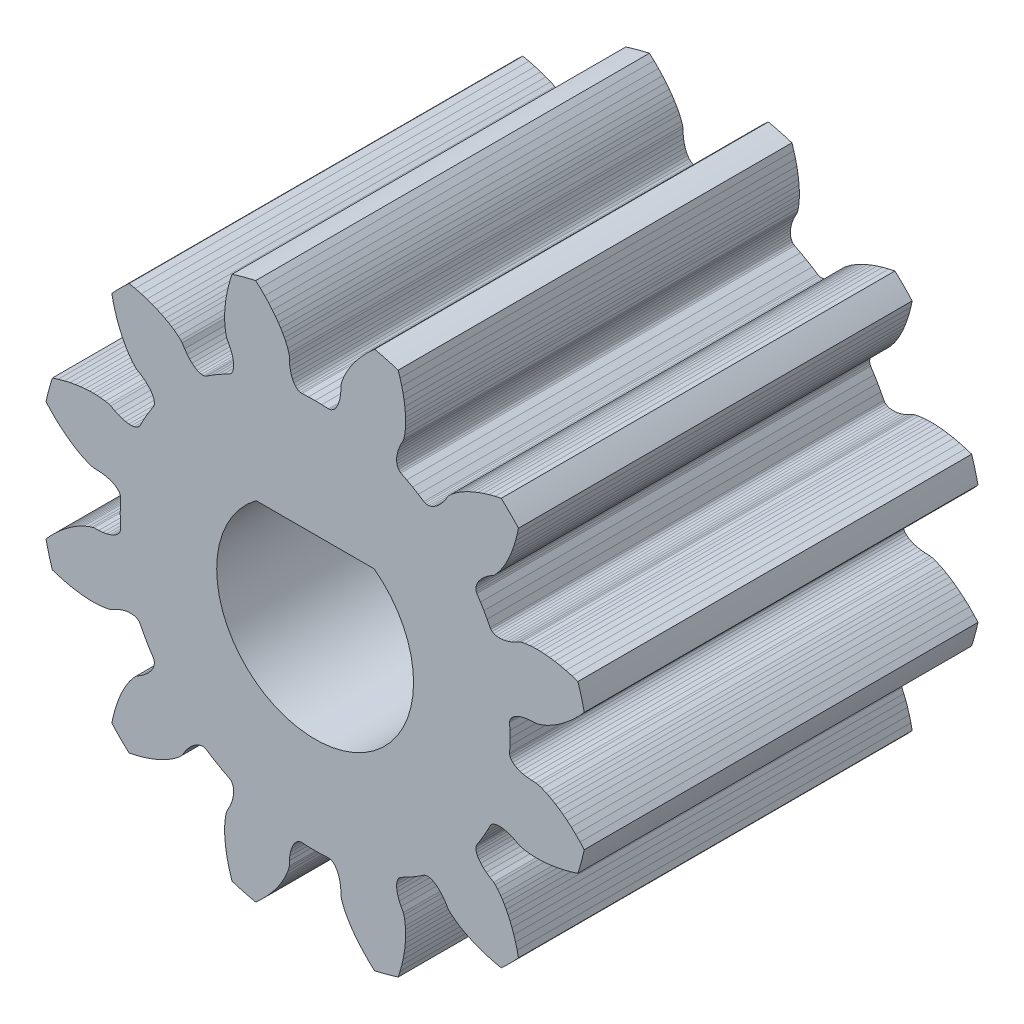
from build123d import *

# Parameters (mm, degrees)
MODEL_R             = 2.5
BOSS_EXTRUDE1_DEPTH = 10
SKETCH2_W           = 5.654663585
SKETCH2_H           = 1.514293935
BOSS_EXTRUDE2_DEPTH = 10


with BuildPart() as part:
    # Model → Boss-Extrude1 (new body)
    with BuildSketch(Plane.XY):
        with BuildLine():
            Line((30.8693845, -4.5708333), (30.9097848, -4.4160686))
            Line((30.9097848, -4.4160686), (30.953786, -4.2724809))
            Line((30.953786, -4.2724809), (31.0002786, -4.1407685))
            Line((31.0002786, -4.1407685), (31.0487652, -4.0198098))
            Line((31.0487652, -4.0198098), (31.0976506, -3.9112417))
            Line((31.0976506, -3.9112417), (31.1474591, -3.8119326))
            Line((31.1474591, -3.8119326), (31.1956452, -3.7251533))
            Line((31.1956452, -3.7251533), (31.2429181, -3.6477925))
            Line((31.2429181, -3.6477925), (31.2874834, -3.5813018))
            Line((31.2874834, -3.5813018), (31.3670654, -3.4769619))
            Line((31.3670654, -3.4769619), (31.4284965, -3.4089436))
            Line((31.4284965, -3.4089436), (31.4660329, -3.3745587))
            Line((31.4660329, -3.3745587), (31.5668109, -3.3141113))
            Line((31.5668109, -3.3141113), (31.6546587, -3.2515682))
            Line((31.6546587, -3.2515682), (31.7295821, -3.1879192))
            Line((31.7295821, -3.1879192), (31.7916695, -3.1241177))
            Line((31.7916695, -3.1241177), (31.8410468, -3.0611418))
            Line((31.8410468, -3.0611418), (31.8779217, -2.999911))
            Line((31.8779217, -2.999911), (31.9025353, -2.9413829))
            Line((31.9025353, -2.9413829), (31.9152053, -2.8864481))
            Line((31.9152053, -2.8864481), (31.9162819, -2.8360127))
            Line((31.9162819, -2.8360127), (31.906188, -2.7909297))
            Line((31.906188, -2.7909297), (31.8915643, -2.7611406))
            Line((31.8915643, -2.7611406), (31.8003034, -2.6201521))
            Line((31.8003034, -2.6201521), (31.7131743, -2.475))
            Line((31.7131743, -2.475), (31.6310334, -2.3269679))
            Line((31.6310334, -2.3269679), (31.5545643, -2.1774394))
            Line((31.5545643, -2.1774394), (31.536078, -2.1498803))
            Line((31.536078, -2.1498803), (31.5020819, -2.1185973))
            Line((31.5020819, -2.1185973), (31.4578653, -2.0943119))
            Line((31.4578653, -2.0943119), (31.4039553, -2.0778171))
            Line((31.4039553, -2.0778171), (31.3409617, -2.069869))
            Line((31.3409617, -2.069869), (31.2694968, -2.0711882))
            Line((31.2694968, -2.0711882), (31.1902695, -2.0824623))
            Line((31.1902695, -2.0824623), (31.1039721, -2.1043308))
            Line((31.1039721, -2.1043308), (31.0113887, -2.1373918))
            Line((31.0113887, -2.1373918), (30.9133009, -2.1821987))
            Line((30.9133009, -2.1821987), (30.8105629, -2.2392513))
            Line((30.8105629, -2.2392513), (30.7620165, -2.2545664))
            Line((30.7620165, -2.2545664), (30.6723954, -2.2737581))
            Line((30.6723954, -2.2737581), (30.5422434, -2.2905082))
            Line((30.5422434, -2.2905082), (30.4623781, -2.2958575))
            Line((30.4623781, -2.2958575), (30.3717452, -2.2981167))
            Line((30.3717452, -2.2981167), (30.2724991, -2.2964574))
            Line((30.2724991, -2.2964574), (30.1615906, -2.2899383))
            Line((30.1615906, -2.2899383), (30.0431252, -2.2779902))
            Line((30.0431252, -2.2779902), (29.9141286, -2.2595015))
            Line((29.9141286, -2.2595015), (29.776816, -2.2339091))
            Line((29.776816, -2.2339091), (29.6304648, -2.2002214))
            Line((29.6304648, -2.2002214), (29.4762345, -2.1578267))
            Line((29.4762345, -2.1578267), (29.325472271, -2.109558904))
            ThreePointArc((29.325472271, -2.109558904), (29.23854966, -1.811725181), (29.164909974, -1.510332309))
            Line((29.164909974, -1.510332309), (29.27134, -1.39315))
            Line((29.27134, -1.39315), (29.38371, -1.27932))
            Line((29.38371, -1.27932), (29.49361, -1.17697))
            Line((29.49361, -1.17697), (29.59973, -1.08615))
            Line((29.59973, -1.08615), (29.7022, -1.00564))
            Line((29.7022, -1.00564), (29.79882, -0.93606))
            Line((29.79882, -0.93606), (29.89161, -0.87496))
            Line((29.89161, -0.87496), (29.97673, -0.8239))
            Line((29.97673, -0.8239), (30.05635, -0.78054))
            Line((30.05635, -0.78054), (30.12819, -0.74524))
            Line((30.12819, -0.74524), (30.24928, -0.69467))
            Line((30.24928, -0.69467), (30.33649, -0.66648))
            Line((30.33649, -0.66648), (30.38619, -0.65547))
            Line((30.38619, -0.65547), (30.50369, -0.65351))
            Line((30.50369, -0.65351), (30.61104, -0.64327))
            Line((30.61104, -0.64327), (30.70775, -0.62561))
            Line((30.70775, -0.62561), (30.79342, -0.6014))
            Line((30.79342, -0.6014), (30.86767, -0.57155))
            Line((30.86767, -0.57155), (30.93022, -0.53696))
            Line((30.93022, -0.53696), (30.9808, -0.49858))
            Line((30.9808, -0.49858), (31.01924, -0.45734))
            Line((31.01924, -0.45734), (31.04539, -0.4142))
            Line((31.04539, -0.4142), (31.05919, -0.37011))
            Line((31.05919, -0.37011), (31.06142, -0.337))
            Line((31.06142, -0.337), (31.05288, -0.16927))
            Line((31.05288, -0.16927), (31.05, 0))
            Line((31.05, 0), (31.05288, 0.16927))
            Line((31.05288, 0.16927), (31.06142, 0.337))
            Line((31.06142, 0.337), (31.05919, 0.37011))
            Line((31.05919, 0.37011), (31.04539, 0.4142))
            Line((31.04539, 0.4142), (31.01924, 0.45734))
            Line((31.01924, 0.45734), (30.9808, 0.49858))
            Line((30.9808, 0.49858), (30.93022, 0.53696))
            Line((30.93022, 0.53696), (30.86767, 0.57155))
            Line((30.86767, 0.57155), (30.79342, 0.6014))
            Line((30.79342, 0.6014), (30.70775, 0.62561))
            Line((30.70775, 0.62561), (30.61104, 0.64327))
            Line((30.61104, 0.64327), (30.50369, 0.65351))
            Line((30.50369, 0.65351), (30.38619, 0.65547))
            Line((30.38619, 0.65547), (30.33649, 0.66648))
            Line((30.33649, 0.66648), (30.24928, 0.69467))
            Line((30.24928, 0.69467), (30.12819, 0.74524))
            Line((30.12819, 0.74524), (30.05635, 0.78054))
            Line((30.05635, 0.78054), (29.97673, 0.8239))
            Line((29.97673, 0.8239), (29.89161, 0.87496))
            Line((29.89161, 0.87496), (29.79882, 0.93606))
            Line((29.79882, 0.93606), (29.7022, 1.00564))
            Line((29.7022, 1.00564), (29.59973, 1.08615))
            Line((29.59973, 1.08615), (29.49361, 1.17697))
            Line((29.49361, 1.17697), (29.38371, 1.27932))
            Line((29.38371, 1.27932), (29.27134, 1.39315))
            Line((29.27134, 1.39315), (29.164909974, 1.510332309))
            ThreePointArc((29.164909974, 1.510332309), (29.23854966, 1.811725181), (29.325472271, 2.109558904))
            Line((29.325472271, 2.109558904), (29.4762345, 2.1578267))
            Line((29.4762345, 2.1578267), (29.6304648, 2.2002214))
            Line((29.6304648, 2.2002214), (29.776816, 2.2339091))
            Line((29.776816, 2.2339091), (29.9141286, 2.2595015))
            Line((29.9141286, 2.2595015), (30.0431252, 2.2779902))
            Line((30.0431252, 2.2779902), (30.1615906, 2.2899383))
            Line((30.1615906, 2.2899383), (30.2724991, 2.2964574))
            Line((30.2724991, 2.2964574), (30.3717452, 2.2981167))
            Line((30.3717452, 2.2981167), (30.4623781, 2.2958575))
            Line((30.4623781, 2.2958575), (30.5422434, 2.2905082))
            Line((30.5422434, 2.2905082), (30.6723954, 2.2737581))
            Line((30.6723954, 2.2737581), (30.7620165, 2.2545664))
            Line((30.7620165, 2.2545664), (30.8105629, 2.2392513))
            Line((30.8105629, 2.2392513), (30.9133009, 2.1821987))
            Line((30.9133009, 2.1821987), (31.0113887, 2.1373918))
            Line((31.0113887, 2.1373918), (31.1039721, 2.1043308))
            Line((31.1039721, 2.1043308), (31.1902695, 2.0824623))
            Line((31.1902695, 2.0824623), (31.2694968, 2.0711882))
            Line((31.2694968, 2.0711882), (31.3409617, 2.069869))
            Line((31.3409617, 2.069869), (31.4039553, 2.0778171))
            Line((31.4039553, 2.0778171), (31.4578653, 2.0943119))
            Line((31.4578653, 2.0943119), (31.5020819, 2.1185973))
            Line((31.5020819, 2.1185973), (31.536078, 2.1498803))
            Line((31.536078, 2.1498803), (31.5545643, 2.1774394))
            Line((31.5545643, 2.1774394), (31.6310334, 2.3269679))
            Line((31.6310334, 2.3269679), (31.7131743, 2.475))
            Line((31.7131743, 2.475), (31.8003034, 2.6201521))
            Line((31.8003034, 2.6201521), (31.8915643, 2.7611406))
            Line((31.8915643, 2.7611406), (31.906188, 2.7909297))
            Line((31.906188, 2.7909297), (31.9162819, 2.8360127))
            Line((31.9162819, 2.8360127), (31.9152053, 2.8864481))
            Line((31.9152053, 2.8864481), (31.9025353, 2.9413829))
            Line((31.9025353, 2.9413829), (31.8779217, 2.999911))
            Line((31.8779217, 2.999911), (31.8410468, 3.0611418))
            Line((31.8410468, 3.0611418), (31.7916695, 3.1241177))
            Line((31.7916695, 3.1241177), (31.7295821, 3.1879192))
            Line((31.7295821, 3.1879192), (31.6546587, 3.2515682))
            Line((31.6546587, 3.2515682), (31.5668109, 3.3141113))
            Line((31.5668109, 3.3141113), (31.4660329, 3.3745587))
            Line((31.4660329, 3.3745587), (31.4284965, 3.4089436))
            Line((31.4284965, 3.4089436), (31.3670654, 3.4769619))
            Line((31.3670654, 3.4769619), (31.2874834, 3.5813018))
            Line((31.2874834, 3.5813018), (31.2429181, 3.6477925))
            Line((31.2429181, 3.6477925), (31.1956452, 3.7251533))
            Line((31.1956452, 3.7251533), (31.1474591, 3.8119326))
            Line((31.1474591, 3.8119326), (31.0976506, 3.9112417))
            Line((31.0976506, 3.9112417), (31.0487652, 4.0198098))
            Line((31.0487652, 4.0198098), (31.0002786, 4.1407685))
            Line((31.0002786, 4.1407685), (30.953786, 4.2724809))
            Line((30.953786, 4.2724809), (30.9097848, 4.4160686))
            Line((30.9097848, 4.4160686), (30.8693845, 4.5708333))
            Line((30.8693845, 4.5708333), (30.83580457, 4.725531132))
            ThreePointArc((30.83580457, 4.725531132), (31.050274832, 4.949725168), (31.274468868, 5.16419543))
            Line((31.274468868, 5.16419543), (31.4291667, 5.1306155))
            Line((31.4291667, 5.1306155), (31.5839314, 5.0902152))
            Line((31.5839314, 5.0902152), (31.7275191, 5.046214))
            Line((31.7275191, 5.046214), (31.8592315, 4.9997214))
            Line((31.8592315, 4.9997214), (31.9801902, 4.9512348))
            Line((31.9801902, 4.9512348), (32.0887583, 4.9023494))
            Line((32.0887583, 4.9023494), (32.1880674, 4.8525409))
            Line((32.1880674, 4.8525409), (32.2748467, 4.8043548))
            Line((32.2748467, 4.8043548), (32.3522075, 4.7570819))
            Line((32.3522075, 4.7570819), (32.4186982, 4.7125166))
            Line((32.4186982, 4.7125166), (32.5230381, 4.6329346))
            Line((32.5230381, 4.6329346), (32.5910564, 4.5715035))
            Line((32.5910564, 4.5715035), (32.6254413, 4.5339671))
            Line((32.6254413, 4.5339671), (32.6858887, 4.4331891))
            Line((32.6858887, 4.4331891), (32.7484318, 4.3453413))
            Line((32.7484318, 4.3453413), (32.8120808, 4.2704179))
            Line((32.8120808, 4.2704179), (32.8758823, 4.2083305))
            Line((32.8758823, 4.2083305), (32.9388582, 4.1589532))
            Line((32.9388582, 4.1589532), (33.000089, 4.1220783))
            Line((33.000089, 4.1220783), (33.0586171, 4.0974647))
            Line((33.0586171, 4.0974647), (33.1135519, 4.0847947))
            Line((33.1135519, 4.0847947), (33.1639873, 4.0837181))
            Line((33.1639873, 4.0837181), (33.2090703, 4.093812))
            Line((33.2090703, 4.093812), (33.2388594, 4.1084357))
            Line((33.2388594, 4.1084357), (33.3798479, 4.1996966))
            Line((33.3798479, 4.1996966), (33.525, 4.2868257))
            Line((33.525, 4.2868257), (33.6730321, 4.3689666))
            Line((33.6730321, 4.3689666), (33.8225606, 4.4454357))
            Line((33.8225606, 4.4454357), (33.8501197, 4.463922))
            Line((33.8501197, 4.463922), (33.8814027, 4.4979181))
            Line((33.8814027, 4.4979181), (33.9056881, 4.5421347))
            Line((33.9056881, 4.5421347), (33.9221829, 4.5960447))
            Line((33.9221829, 4.5960447), (33.930131, 4.6590383))
            Line((33.930131, 4.6590383), (33.9288118, 4.7305032))
            Line((33.9288118, 4.7305032), (33.9175377, 4.8097305))
            Line((33.9175377, 4.8097305), (33.8956692, 4.8960279))
            Line((33.8956692, 4.8960279), (33.8626082, 4.9886113))
            Line((33.8626082, 4.9886113), (33.8178013, 5.0866991))
            Line((33.8178013, 5.0866991), (33.7607487, 5.1894371))
            Line((33.7607487, 5.1894371), (33.7454336, 5.2379835))
            Line((33.7454336, 5.2379835), (33.7262419, 5.3276046))
            Line((33.7262419, 5.3276046), (33.7094918, 5.4577566))
            Line((33.7094918, 5.4577566), (33.7041425, 5.5376219))
            Line((33.7041425, 5.5376219), (33.7018833, 5.6282548))
            Line((33.7018833, 5.6282548), (33.7035426, 5.7275009))
            Line((33.7035426, 5.7275009), (33.7100617, 5.8384094))
            Line((33.7100617, 5.8384094), (33.7220098, 5.9568748))
            Line((33.7220098, 5.9568748), (33.7404985, 6.0858714))
            Line((33.7404985, 6.0858714), (33.7660909, 6.223184))
            Line((33.7660909, 6.223184), (33.7997786, 6.3695352))
            Line((33.7997786, 6.3695352), (33.8421733, 6.5237655))
            Line((33.8421733, 6.5237655), (33.890441096, 6.674527729))
            ThreePointArc((33.890441096, 6.674527729), (34.188274819, 6.76145034), (34.489667691, 6.835090026))
            Line((34.489667691, 6.835090026), (34.60685, 6.72866))
            Line((34.60685, 6.72866), (34.72068, 6.61629))
            Line((34.72068, 6.61629), (34.82303, 6.50639))
            Line((34.82303, 6.50639), (34.91385, 6.40027))
            Line((34.91385, 6.40027), (34.99436, 6.2978))
            Line((34.99436, 6.2978), (35.06394, 6.20118))
            Line((35.06394, 6.20118), (35.12504, 6.10839))
            Line((35.12504, 6.10839), (35.1761, 6.02327))
            Line((35.1761, 6.02327), (35.21946, 5.94365))
            Line((35.21946, 5.94365), (35.25476, 5.87181))
            Line((35.25476, 5.87181), (35.30533, 5.75072))
            Line((35.30533, 5.75072), (35.33352, 5.66351))
            Line((35.33352, 5.66351), (35.34453, 5.61381))
            Line((35.34453, 5.61381), (35.34649, 5.49631))
            Line((35.34649, 5.49631), (35.35673, 5.38896))
            Line((35.35673, 5.38896), (35.37439, 5.29225))
            Line((35.37439, 5.29225), (35.3986, 5.20658))
            Line((35.3986, 5.20658), (35.42845, 5.13233))
            Line((35.42845, 5.13233), (35.46304, 5.06978))
            Line((35.46304, 5.06978), (35.50142, 5.0192))
            Line((35.50142, 5.0192), (35.54266, 4.98076))
            Line((35.54266, 4.98076), (35.5858, 4.95461))
            Line((35.5858, 4.95461), (35.62989, 4.94081))
            Line((35.62989, 4.94081), (35.663, 4.93858))
            Line((35.663, 4.93858), (35.83073, 4.94712))
            Line((35.83073, 4.94712), (36, 4.95))
            Line((36, 4.95), (36.16927, 4.94712))
            Line((36.16927, 4.94712), (36.337, 4.93858))
            Line((36.337, 4.93858), (36.37011, 4.94081))
            Line((36.37011, 4.94081), (36.4142, 4.95461))
            Line((36.4142, 4.95461), (36.45734, 4.98076))
            Line((36.45734, 4.98076), (36.49858, 5.0192))
            Line((36.49858, 5.0192), (36.53696, 5.06978))
            Line((36.53696, 5.06978), (36.57155, 5.13233))
            Line((36.57155, 5.13233), (36.6014, 5.20658))
            Line((36.6014, 5.20658), (36.62561, 5.29225))
            Line((36.62561, 5.29225), (36.64327, 5.38896))
            Line((36.64327, 5.38896), (36.65351, 5.49631))
            Line((36.65351, 5.49631), (36.65547, 5.61381))
            Line((36.65547, 5.61381), (36.66648, 5.66351))
            Line((36.66648, 5.66351), (36.69467, 5.75072))
            Line((36.69467, 5.75072), (36.74524, 5.87181))
            Line((36.74524, 5.87181), (36.78054, 5.94365))
            Line((36.78054, 5.94365), (36.8239, 6.02327))
            Line((36.8239, 6.02327), (36.87496, 6.10839))
            Line((36.87496, 6.10839), (36.93606, 6.20118))
            Line((36.93606, 6.20118), (37.00564, 6.2978))
            Line((37.00564, 6.2978), (37.08615, 6.40027))
            Line((37.08615, 6.40027), (37.17697, 6.50639))
            Line((37.17697, 6.50639), (37.27932, 6.61629))
            Line((37.27932, 6.61629), (37.39315, 6.72866))
            Line((37.39315, 6.72866), (37.510332309, 6.835090026))
            ThreePointArc((37.510332309, 6.835090026), (37.811725181, 6.76145034), (38.109558904, 6.674527729))
            Line((38.109558904, 6.674527729), (38.1578267, 6.5237655))
            Line((38.1578267, 6.5237655), (38.2002214, 6.3695352))
            Line((38.2002214, 6.3695352), (38.2339091, 6.223184))
            Line((38.2339091, 6.223184), (38.2595015, 6.0858714))
            Line((38.2595015, 6.0858714), (38.2779902, 5.9568748))
            Line((38.2779902, 5.9568748), (38.2899383, 5.8384094))
            Line((38.2899383, 5.8384094), (38.2964574, 5.7275009))
            Line((38.2964574, 5.7275009), (38.2981167, 5.6282548))
            Line((38.2981167, 5.6282548), (38.2958575, 5.5376219))
            Line((38.2958575, 5.5376219), (38.2905082, 5.4577566))
            Line((38.2905082, 5.4577566), (38.2737581, 5.3276046))
            Line((38.2737581, 5.3276046), (38.2545664, 5.2379835))
            Line((38.2545664, 5.2379835), (38.2392513, 5.1894371))
            Line((38.2392513, 5.1894371), (38.1821987, 5.0866991))
            Line((38.1821987, 5.0866991), (38.1373918, 4.9886113))
            Line((38.1373918, 4.9886113), (38.1043308, 4.8960279))
            Line((38.1043308, 4.8960279), (38.0824623, 4.8097305))
            Line((38.0824623, 4.8097305), (38.0711882, 4.7305032))
            Line((38.0711882, 4.7305032), (38.069869, 4.6590383))
            Line((38.069869, 4.6590383), (38.0778171, 4.5960447))
            Line((38.0778171, 4.5960447), (38.0943119, 4.5421347))
            Line((38.0943119, 4.5421347), (38.1185973, 4.4979181))
            Line((38.1185973, 4.4979181), (38.1498803, 4.463922))
            Line((38.1498803, 4.463922), (38.1774394, 4.4454357))
            Line((38.1774394, 4.4454357), (38.3269679, 4.3689666))
            Line((38.3269679, 4.3689666), (38.475, 4.2868257))
            Line((38.475, 4.2868257), (38.6201521, 4.1996966))
            Line((38.6201521, 4.1996966), (38.7611406, 4.1084357))
            Line((38.7611406, 4.1084357), (38.7909297, 4.093812))
            Line((38.7909297, 4.093812), (38.8360127, 4.0837181))
            Line((38.8360127, 4.0837181), (38.8864481, 4.0847947))
            Line((38.8864481, 4.0847947), (38.9413829, 4.0974647))
            Line((38.9413829, 4.0974647), (38.999911, 4.1220783))
            Line((38.999911, 4.1220783), (39.0611418, 4.1589532))
            Line((39.0611418, 4.1589532), (39.1241177, 4.2083305))
            Line((39.1241177, 4.2083305), (39.1879192, 4.2704179))
            Line((39.1879192, 4.2704179), (39.2515682, 4.3453413))
            Line((39.2515682, 4.3453413), (39.3141113, 4.4331891))
            Line((39.3141113, 4.4331891), (39.3745587, 4.5339671))
            Line((39.3745587, 4.5339671), (39.4089436, 4.5715035))
            Line((39.4089436, 4.5715035), (39.4769619, 4.6329346))
            Line((39.4769619, 4.6329346), (39.5813018, 4.7125166))
            Line((39.5813018, 4.7125166), (39.6477925, 4.7570819))
            Line((39.6477925, 4.7570819), (39.7251533, 4.8043548))
            Line((39.7251533, 4.8043548), (39.8119326, 4.8525409))
            Line((39.8119326, 4.8525409), (39.9112417, 4.9023494))
            Line((39.9112417, 4.9023494), (40.0198098, 4.9512348))
            Line((40.0198098, 4.9512348), (40.1407685, 4.9997214))
            Line((40.1407685, 4.9997214), (40.2724809, 5.046214))
            Line((40.2724809, 5.046214), (40.4160686, 5.0902152))
            Line((40.4160686, 5.0902152), (40.5708333, 5.1306155))
            Line((40.5708333, 5.1306155), (40.725531132, 5.16419543))
            ThreePointArc((40.725531132, 5.16419543), (40.949725168, 4.949725168), (41.16419543, 4.725531132))
            Line((41.16419543, 4.725531132), (41.1306155, 4.5708333))
            Line((41.1306155, 4.5708333), (41.0902152, 4.4160686))
            Line((41.0902152, 4.4160686), (41.046214, 4.2724809))
            Line((41.046214, 4.2724809), (40.9997214, 4.1407685))
            Line((40.9997214, 4.1407685), (40.9512348, 4.0198098))
            Line((40.9512348, 4.0198098), (40.9023494, 3.9112417))
            Line((40.9023494, 3.9112417), (40.8525409, 3.8119326))
            Line((40.8525409, 3.8119326), (40.8043548, 3.7251533))
            Line((40.8043548, 3.7251533), (40.7570819, 3.6477925))
            Line((40.7570819, 3.6477925), (40.7125166, 3.5813018))
            Line((40.7125166, 3.5813018), (40.6329346, 3.4769619))
            Line((40.6329346, 3.4769619), (40.5715035, 3.4089436))
            Line((40.5715035, 3.4089436), (40.5339671, 3.3745587))
            Line((40.5339671, 3.3745587), (40.4331891, 3.3141113))
            Line((40.4331891, 3.3141113), (40.3453413, 3.2515682))
            Line((40.3453413, 3.2515682), (40.2704179, 3.1879192))
            Line((40.2704179, 3.1879192), (40.2083305, 3.1241177))
            Line((40.2083305, 3.1241177), (40.1589532, 3.0611418))
            Line((40.1589532, 3.0611418), (40.1220783, 2.999911))
            Line((40.1220783, 2.999911), (40.0974647, 2.9413829))
            Line((40.0974647, 2.9413829), (40.0847947, 2.8864481))
            Line((40.0847947, 2.8864481), (40.0837181, 2.8360127))
            Line((40.0837181, 2.8360127), (40.093812, 2.7909297))
            Line((40.093812, 2.7909297), (40.1084357, 2.7611406))
            Line((40.1084357, 2.7611406), (40.1996966, 2.6201521))
            Line((40.1996966, 2.6201521), (40.2868257, 2.475))
            Line((40.2868257, 2.475), (40.3689666, 2.3269679))
            Line((40.3689666, 2.3269679), (40.4454357, 2.1774394))
            Line((40.4454357, 2.1774394), (40.463922, 2.1498803))
            Line((40.463922, 2.1498803), (40.4979181, 2.1185973))
            Line((40.4979181, 2.1185973), (40.5421347, 2.0943119))
            Line((40.5421347, 2.0943119), (40.5960447, 2.0778171))
            Line((40.5960447, 2.0778171), (40.6590383, 2.069869))
            Line((40.6590383, 2.069869), (40.7305032, 2.0711882))
            Line((40.7305032, 2.0711882), (40.8097305, 2.0824623))
            Line((40.8097305, 2.0824623), (40.8960279, 2.1043308))
            Line((40.8960279, 2.1043308), (40.9886113, 2.1373918))
            Line((40.9886113, 2.1373918), (41.0866991, 2.1821987))
            Line((41.0866991, 2.1821987), (41.1894371, 2.2392513))
            Line((41.1894371, 2.2392513), (41.2379835, 2.2545664))
            Line((41.2379835, 2.2545664), (41.3276046, 2.2737581))
            Line((41.3276046, 2.2737581), (41.4577566, 2.2905082))
            Line((41.4577566, 2.2905082), (41.5376219, 2.2958575))
            Line((41.5376219, 2.2958575), (41.6282548, 2.2981167))
            Line((41.6282548, 2.2981167), (41.7275009, 2.2964574))
            Line((41.7275009, 2.2964574), (41.8384094, 2.2899383))
            Line((41.8384094, 2.2899383), (41.9568748, 2.2779902))
            Line((41.9568748, 2.2779902), (42.0858714, 2.2595015))
            Line((42.0858714, 2.2595015), (42.223184, 2.2339091))
            Line((42.223184, 2.2339091), (42.3695352, 2.2002214))
            Line((42.3695352, 2.2002214), (42.5237655, 2.1578267))
            Line((42.5237655, 2.1578267), (42.674527729, 2.109558904))
            ThreePointArc((42.674527729, 2.109558904), (42.76145034, 1.811725181), (42.835090026, 1.510332309))
            Line((42.835090026, 1.510332309), (42.72866, 1.39315))
            Line((42.72866, 1.39315), (42.61629, 1.27932))
            Line((42.61629, 1.27932), (42.50639, 1.17697))
            Line((42.50639, 1.17697), (42.40027, 1.08615))
            Line((42.40027, 1.08615), (42.2978, 1.00564))
            Line((42.2978, 1.00564), (42.20118, 0.93606))
            Line((42.20118, 0.93606), (42.10839, 0.87496))
            Line((42.10839, 0.87496), (42.02327, 0.8239))
            Line((42.02327, 0.8239), (41.94365, 0.78054))
            Line((41.94365, 0.78054), (41.87181, 0.74524))
            Line((41.87181, 0.74524), (41.75072, 0.69467))
            Line((41.75072, 0.69467), (41.66351, 0.66648))
            Line((41.66351, 0.66648), (41.61381, 0.65547))
            Line((41.61381, 0.65547), (41.49631, 0.65351))
            Line((41.49631, 0.65351), (41.38896, 0.64327))
            Line((41.38896, 0.64327), (41.29225, 0.62561))
            Line((41.29225, 0.62561), (41.20658, 0.6014))
            Line((41.20658, 0.6014), (41.13233, 0.57155))
            Line((41.13233, 0.57155), (41.06978, 0.53696))
            Line((41.06978, 0.53696), (41.0192, 0.49858))
            Line((41.0192, 0.49858), (40.98076, 0.45734))
            Line((40.98076, 0.45734), (40.95461, 0.4142))
            Line((40.95461, 0.4142), (40.94081, 0.37011))
            Line((40.94081, 0.37011), (40.93858, 0.337))
            Line((40.93858, 0.337), (40.94712, 0.16927))
            Line((40.94712, 0.16927), (40.95, 0))
            Line((40.95, 0), (40.94712, -0.16927))
            Line((40.94712, -0.16927), (40.93858, -0.337))
            Line((40.93858, -0.337), (40.94081, -0.37011))
            Line((40.94081, -0.37011), (40.95461, -0.4142))
            Line((40.95461, -0.4142), (40.98076, -0.45734))
            Line((40.98076, -0.45734), (41.0192, -0.49858))
            Line((41.0192, -0.49858), (41.06978, -0.53696))
            Line((41.06978, -0.53696), (41.13233, -0.57155))
            Line((41.13233, -0.57155), (41.20658, -0.6014))
            Line((41.20658, -0.6014), (41.29225, -0.62561))
            Line((41.29225, -0.62561), (41.38896, -0.64327))
            Line((41.38896, -0.64327), (41.49631, -0.65351))
            Line((41.49631, -0.65351), (41.61381, -0.65547))
            Line((41.61381, -0.65547), (41.66351, -0.66648))
            Line((41.66351, -0.66648), (41.75072, -0.69467))
            Line((41.75072, -0.69467), (41.87181, -0.74524))
            Line((41.87181, -0.74524), (41.94365, -0.78054))
            Line((41.94365, -0.78054), (42.02327, -0.8239))
            Line((42.02327, -0.8239), (42.10839, -0.87496))
            Line((42.10839, -0.87496), (42.20118, -0.93606))
            Line((42.20118, -0.93606), (42.2978, -1.00564))
            Line((42.2978, -1.00564), (42.40027, -1.08615))
            Line((42.40027, -1.08615), (42.50639, -1.17697))
            Line((42.50639, -1.17697), (42.61629, -1.27932))
            Line((42.61629, -1.27932), (42.72866, -1.39315))
            Line((42.72866, -1.39315), (42.835090026, -1.510332309))
            ThreePointArc((42.835090026, -1.510332309), (42.76145034, -1.811725181), (42.674527729, -2.109558904))
            Line((42.674527729, -2.109558904), (42.5237655, -2.1578267))
            Line((42.5237655, -2.1578267), (42.3695352, -2.2002214))
            Line((42.3695352, -2.2002214), (42.223184, -2.2339091))
            Line((42.223184, -2.2339091), (42.0858714, -2.2595015))
            Line((42.0858714, -2.2595015), (41.9568748, -2.2779902))
            Line((41.9568748, -2.2779902), (41.8384094, -2.2899383))
            Line((41.8384094, -2.2899383), (41.7275009, -2.2964574))
            Line((41.7275009, -2.2964574), (41.6282548, -2.2981167))
            Line((41.6282548, -2.2981167), (41.5376219, -2.2958575))
            Line((41.5376219, -2.2958575), (41.4577566, -2.2905082))
            Line((41.4577566, -2.2905082), (41.3276046, -2.2737581))
            Line((41.3276046, -2.2737581), (41.2379835, -2.2545664))
            Line((41.2379835, -2.2545664), (41.1894371, -2.2392513))
            Line((41.1894371, -2.2392513), (41.0866991, -2.1821987))
            Line((41.0866991, -2.1821987), (40.9886113, -2.1373918))
            Line((40.9886113, -2.1373918), (40.8960279, -2.1043308))
            Line((40.8960279, -2.1043308), (40.8097305, -2.0824623))
            Line((40.8097305, -2.0824623), (40.7305032, -2.0711882))
            Line((40.7305032, -2.0711882), (40.6590383, -2.069869))
            Line((40.6590383, -2.069869), (40.5960447, -2.0778171))
            Line((40.5960447, -2.0778171), (40.5421347, -2.0943119))
            Line((40.5421347, -2.0943119), (40.4979181, -2.1185973))
            Line((40.4979181, -2.1185973), (40.463922, -2.1498803))
            Line((40.463922, -2.1498803), (40.4454357, -2.1774394))
            Line((40.4454357, -2.1774394), (40.3689666, -2.3269679))
            Line((40.3689666, -2.3269679), (40.2868257, -2.475))
            Line((40.2868257, -2.475), (40.1996966, -2.6201521))
            Line((40.1996966, -2.6201521), (40.1084357, -2.7611406))
            Line((40.1084357, -2.7611406), (40.093812, -2.7909297))
            Line((40.093812, -2.7909297), (40.0837181, -2.8360127))
            Line((40.0837181, -2.8360127), (40.0847947, -2.8864481))
            Line((40.0847947, -2.8864481), (40.0974647, -2.9413829))
            Line((40.0974647, -2.9413829), (40.1220783, -2.999911))
            Line((40.1220783, -2.999911), (40.1589532, -3.0611418))
            Line((40.1589532, -3.0611418), (40.2083305, -3.1241177))
            Line((40.2083305, -3.1241177), (40.2704179, -3.1879192))
            Line((40.2704179, -3.1879192), (40.3453413, -3.2515682))
            Line((40.3453413, -3.2515682), (40.4331891, -3.3141113))
            Line((40.4331891, -3.3141113), (40.5339671, -3.3745587))
            Line((40.5339671, -3.3745587), (40.5715035, -3.4089436))
            Line((40.5715035, -3.4089436), (40.6329346, -3.4769619))
            Line((40.6329346, -3.4769619), (40.7125166, -3.5813018))
            Line((40.7125166, -3.5813018), (40.7570819, -3.6477925))
            Line((40.7570819, -3.6477925), (40.8043548, -3.7251533))
            Line((40.8043548, -3.7251533), (40.8525409, -3.8119326))
            Line((40.8525409, -3.8119326), (40.9023494, -3.9112417))
            Line((40.9023494, -3.9112417), (40.9512348, -4.0198098))
            Line((40.9512348, -4.0198098), (40.9997214, -4.1407685))
            Line((40.9997214, -4.1407685), (41.046214, -4.2724809))
            Line((41.046214, -4.2724809), (41.0902152, -4.4160686))
            Line((41.0902152, -4.4160686), (41.1306155, -4.5708333))
            Line((41.1306155, -4.5708333), (41.16419543, -4.725531132))
            ThreePointArc((41.16419543, -4.725531132), (40.949725168, -4.949725168), (40.725531132, -5.16419543))
            Line((40.725531132, -5.16419543), (40.5708333, -5.1306155))
            Line((40.5708333, -5.1306155), (40.4160686, -5.0902152))
            Line((40.4160686, -5.0902152), (40.2724809, -5.046214))
            Line((40.2724809, -5.046214), (40.1407685, -4.9997214))
            Line((40.1407685, -4.9997214), (40.0198098, -4.9512348))
            Line((40.0198098, -4.9512348), (39.9112417, -4.9023494))
            Line((39.9112417, -4.9023494), (39.8119326, -4.8525409))
            Line((39.8119326, -4.8525409), (39.7251533, -4.8043548))
            Line((39.7251533, -4.8043548), (39.6477925, -4.7570819))
            Line((39.6477925, -4.7570819), (39.5813018, -4.7125166))
            Line((39.5813018, -4.7125166), (39.4769619, -4.6329346))
            Line((39.4769619, -4.6329346), (39.4089436, -4.5715035))
            Line((39.4089436, -4.5715035), (39.3745587, -4.5339671))
            Line((39.3745587, -4.5339671), (39.3141113, -4.4331891))
            Line((39.3141113, -4.4331891), (39.2515682, -4.3453413))
            Line((39.2515682, -4.3453413), (39.1879192, -4.2704179))
            Line((39.1879192, -4.2704179), (39.1241177, -4.2083305))
            Line((39.1241177, -4.2083305), (39.0611418, -4.1589532))
            Line((39.0611418, -4.1589532), (38.999911, -4.1220783))
            Line((38.999911, -4.1220783), (38.9413829, -4.0974647))
            Line((38.9413829, -4.0974647), (38.8864481, -4.0847947))
            Line((38.8864481, -4.0847947), (38.8360127, -4.0837181))
            Line((38.8360127, -4.0837181), (38.7909297, -4.093812))
            Line((38.7909297, -4.093812), (38.7611406, -4.1084357))
            Line((38.7611406, -4.1084357), (38.6201521, -4.1996966))
            Line((38.6201521, -4.1996966), (38.475, -4.2868257))
            Line((38.475, -4.2868257), (38.3269679, -4.3689666))
            Line((38.3269679, -4.3689666), (38.1774394, -4.4454357))
            Line((38.1774394, -4.4454357), (38.1498803, -4.463922))
            Line((38.1498803, -4.463922), (38.1185973, -4.4979181))
            Line((38.1185973, -4.4979181), (38.0943119, -4.5421347))
            Line((38.0943119, -4.5421347), (38.0778171, -4.5960447))
            Line((38.0778171, -4.5960447), (38.069869, -4.6590383))
            Line((38.069869, -4.6590383), (38.0711882, -4.7305032))
            Line((38.0711882, -4.7305032), (38.0824623, -4.8097305))
            Line((38.0824623, -4.8097305), (38.1043308, -4.8960279))
            Line((38.1043308, -4.8960279), (38.1373918, -4.9886113))
            Line((38.1373918, -4.9886113), (38.1821987, -5.0866991))
            Line((38.1821987, -5.0866991), (38.2392513, -5.1894371))
            Line((38.2392513, -5.1894371), (38.2545664, -5.2379835))
            Line((38.2545664, -5.2379835), (38.2737581, -5.3276046))
            Line((38.2737581, -5.3276046), (38.2905082, -5.4577566))
            Line((38.2905082, -5.4577566), (38.2958575, -5.5376219))
            Line((38.2958575, -5.5376219), (38.2981167, -5.6282548))
            Line((38.2981167, -5.6282548), (38.2964574, -5.7275009))
            Line((38.2964574, -5.7275009), (38.2899383, -5.8384094))
            Line((38.2899383, -5.8384094), (38.2779902, -5.9568748))
            Line((38.2779902, -5.9568748), (38.2595015, -6.0858714))
            Line((38.2595015, -6.0858714), (38.2339091, -6.223184))
            Line((38.2339091, -6.223184), (38.2002214, -6.3695352))
            Line((38.2002214, -6.3695352), (38.1578267, -6.5237655))
            Line((38.1578267, -6.5237655), (38.109558904, -6.674527729))
            ThreePointArc((38.109558904, -6.674527729), (37.811725181, -6.76145034), (37.510332309, -6.835090026))
            Line((37.510332309, -6.835090026), (37.39315, -6.72866))
            Line((37.39315, -6.72866), (37.27932, -6.61629))
            Line((37.27932, -6.61629), (37.17697, -6.50639))
            Line((37.17697, -6.50639), (37.08615, -6.40027))
            Line((37.08615, -6.40027), (37.00564, -6.2978))
            Line((37.00564, -6.2978), (36.93606, -6.20118))
            Line((36.93606, -6.20118), (36.87496, -6.10839))
            Line((36.87496, -6.10839), (36.8239, -6.02327))
            Line((36.8239, -6.02327), (36.78054, -5.94365))
            Line((36.78054, -5.94365), (36.74524, -5.87181))
            Line((36.74524, -5.87181), (36.69467, -5.75072))
            Line((36.69467, -5.75072), (36.66648, -5.66351))
            Line((36.66648, -5.66351), (36.65547, -5.61381))
            Line((36.65547, -5.61381), (36.65351, -5.49631))
            Line((36.65351, -5.49631), (36.64327, -5.38896))
            Line((36.64327, -5.38896), (36.62561, -5.29225))
            Line((36.62561, -5.29225), (36.6014, -5.20658))
            Line((36.6014, -5.20658), (36.57155, -5.13233))
            Line((36.57155, -5.13233), (36.53696, -5.06978))
            Line((36.53696, -5.06978), (36.49858, -5.0192))
            Line((36.49858, -5.0192), (36.45734, -4.98076))
            Line((36.45734, -4.98076), (36.4142, -4.95461))
            Line((36.4142, -4.95461), (36.37011, -4.94081))
            Line((36.37011, -4.94081), (36.337, -4.93858))
            Line((36.337, -4.93858), (36.16927, -4.94712))
            Line((36.16927, -4.94712), (36, -4.95))
            Line((36, -4.95), (35.83073, -4.94712))
            Line((35.83073, -4.94712), (35.663, -4.93858))
            Line((35.663, -4.93858), (35.62989, -4.94081))
            Line((35.62989, -4.94081), (35.5858, -4.95461))
            Line((35.5858, -4.95461), (35.54266, -4.98076))
            Line((35.54266, -4.98076), (35.50142, -5.0192))
            Line((35.50142, -5.0192), (35.46304, -5.06978))
            Line((35.46304, -5.06978), (35.42845, -5.13233))
            Line((35.42845, -5.13233), (35.3986, -5.20658))
            Line((35.3986, -5.20658), (35.37439, -5.29225))
            Line((35.37439, -5.29225), (35.35673, -5.38896))
            Line((35.35673, -5.38896), (35.34649, -5.49631))
            Line((35.34649, -5.49631), (35.34453, -5.61381))
            Line((35.34453, -5.61381), (35.33352, -5.66351))
            Line((35.33352, -5.66351), (35.30533, -5.75072))
            Line((35.30533, -5.75072), (35.25476, -5.87181))
            Line((35.25476, -5.87181), (35.21946, -5.94365))
            Line((35.21946, -5.94365), (35.1761, -6.02327))
            Line((35.1761, -6.02327), (35.12504, -6.10839))
            Line((35.12504, -6.10839), (35.06394, -6.20118))
            Line((35.06394, -6.20118), (34.99436, -6.2978))
            Line((34.99436, -6.2978), (34.91385, -6.40027))
            Line((34.91385, -6.40027), (34.82303, -6.50639))
            Line((34.82303, -6.50639), (34.72068, -6.61629))
            Line((34.72068, -6.61629), (34.60685, -6.72866))
            Line((34.60685, -6.72866), (34.489667691, -6.835090026))
            ThreePointArc((34.489667691, -6.835090026), (34.188274819, -6.76145034), (33.890441096, -6.674527729))
            Line((33.890441096, -6.674527729), (33.8421733, -6.5237655))
            Line((33.8421733, -6.5237655), (33.7997786, -6.3695352))
            Line((33.7997786, -6.3695352), (33.7660909, -6.223184))
            Line((33.7660909, -6.223184), (33.7404985, -6.0858714))
            Line((33.7404985, -6.0858714), (33.7220098, -5.9568748))
            Line((33.7220098, -5.9568748), (33.7100617, -5.8384094))
            Line((33.7100617, -5.8384094), (33.7035426, -5.7275009))
            Line((33.7035426, -5.7275009), (33.7018833, -5.6282548))
            Line((33.7018833, -5.6282548), (33.7041425, -5.5376219))
            Line((33.7041425, -5.5376219), (33.7094918, -5.4577566))
            Line((33.7094918, -5.4577566), (33.7262419, -5.3276046))
            Line((33.7262419, -5.3276046), (33.7454336, -5.2379835))
            Line((33.7454336, -5.2379835), (33.7607487, -5.1894371))
            Line((33.7607487, -5.1894371), (33.8178013, -5.0866991))
            Line((33.8178013, -5.0866991), (33.8626082, -4.9886113))
            Line((33.8626082, -4.9886113), (33.8956692, -4.8960279))
            Line((33.8956692, -4.8960279), (33.9175377, -4.8097305))
            Line((33.9175377, -4.8097305), (33.9288118, -4.7305032))
            Line((33.9288118, -4.7305032), (33.930131, -4.6590383))
            Line((33.930131, -4.6590383), (33.9221829, -4.5960447))
            Line((33.9221829, -4.5960447), (33.9056881, -4.5421347))
            Line((33.9056881, -4.5421347), (33.8814027, -4.4979181))
            Line((33.8814027, -4.4979181), (33.8501197, -4.463922))
            Line((33.8501197, -4.463922), (33.8225606, -4.4454357))
            Line((33.8225606, -4.4454357), (33.6730321, -4.3689666))
            Line((33.6730321, -4.3689666), (33.525, -4.2868257))
            Line((33.525, -4.2868257), (33.3798479, -4.1996966))
            Line((33.3798479, -4.1996966), (33.2388594, -4.1084357))
            Line((33.2388594, -4.1084357), (33.2090703, -4.093812))
            Line((33.2090703, -4.093812), (33.1639873, -4.0837181))
            Line((33.1639873, -4.0837181), (33.1135519, -4.0847947))
            Line((33.1135519, -4.0847947), (33.0586171, -4.0974647))
            Line((33.0586171, -4.0974647), (33.000089, -4.1220783))
            Line((33.000089, -4.1220783), (32.9388582, -4.1589532))
            Line((32.9388582, -4.1589532), (32.8758823, -4.2083305))
            Line((32.8758823, -4.2083305), (32.8120808, -4.2704179))
            Line((32.8120808, -4.2704179), (32.7484318, -4.3453413))
            Line((32.7484318, -4.3453413), (32.6858887, -4.4331891))
            Line((32.6858887, -4.4331891), (32.6254413, -4.5339671))
            Line((32.6254413, -4.5339671), (32.5910564, -4.5715035))
            Line((32.5910564, -4.5715035), (32.5230381, -4.6329346))
            Line((32.5230381, -4.6329346), (32.4186982, -4.7125166))
            Line((32.4186982, -4.7125166), (32.3522075, -4.7570819))
            Line((32.3522075, -4.7570819), (32.2748467, -4.8043548))
            Line((32.2748467, -4.8043548), (32.1880674, -4.8525409))
            Line((32.1880674, -4.8525409), (32.0887583, -4.9023494))
            Line((32.0887583, -4.9023494), (31.9801902, -4.9512348))
            Line((31.9801902, -4.9512348), (31.8592315, -4.9997214))
            Line((31.8592315, -4.9997214), (31.7275191, -5.046214))
            Line((31.7275191, -5.046214), (31.5839314, -5.0902152))
            Line((31.5839314, -5.0902152), (31.4291667, -5.1306155))
            Line((31.4291667, -5.1306155), (31.274468868, -5.16419543))
            ThreePointArc((31.274468868, -5.16419543), (31.050274832, -4.949725168), (30.83580457, -4.725531132))
            Line((30.83580457, -4.725531132), (30.8693845, -4.5708333))
        make_face()
        with Locations((36, 0)):
            Circle(MODEL_R, mode=Mode.SUBTRACT)
    extrude(amount=BOSS_EXTRUDE1_DEPTH)

    # Sketch2 → Boss-Extrude2 (add)
    with BuildSketch(Plane.XY.offset(10)):
        with Locations((36.011354747, 2.757146968)):
            Rectangle(SKETCH2_W, SKETCH2_H)
    extrude(amount=-BOSS_EXTRUDE2_DEPTH)


solid = part.part
